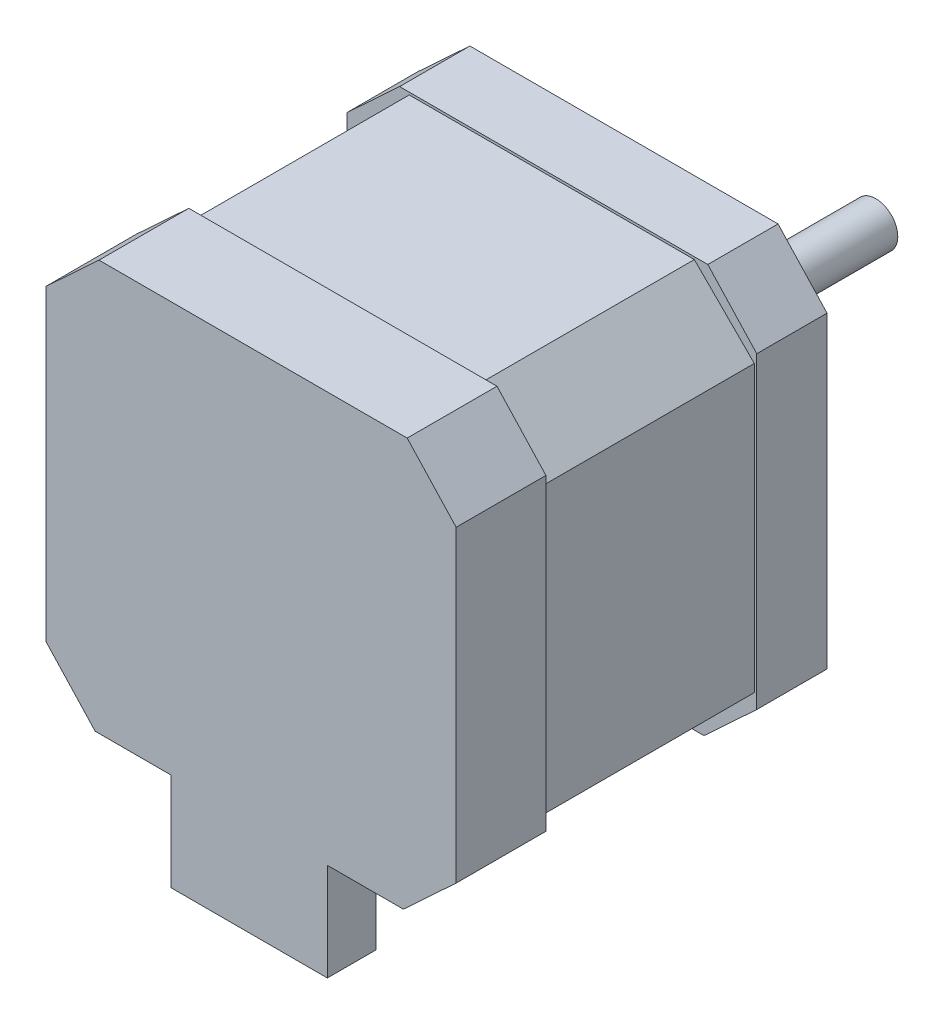
from build123d import *

# Parameters (mm, degrees)
RESSALTO_EXTRUS_O1_DEPTH   = 38
CORTE_EXTRUS_O_FINA1_START = -30.8
CORTE_EXTRUS_O_FINA1_DEPTH = 21.6
ESBO_O3_R                  = 2.25
RESSALTO_EXTRUS_O2_DEPTH   = 26
ESBO_O4_R                  = 10
RESSALTO_EXTRUS_O3_DEPTH   = 2
ESBO_O5_R                  = 1.5
CORTE_EXTRUS_O1_DEPTH      = 10
ESBO_O7_W                  = 16
ESBO_O7_H                  = 5
RESSALTO_EXTRUS_O4_DEPTH   = 10


# Read off the part's stored shape, not the designer's step: Corte-Extrusão-Fina1
with BuildPart() as part:
    # Esboço1 → Ressalto-extrusão1 (new body)
    with BuildSketch(Plane.XY):
        Polygon((-21, -15.592171873), (-15.984175996, -21), (15.592171873, -21), (21, -15.984175996), (21, 15.592171873), (15.984175996, 21), (-15.592171873, 21), (-21, 15.984175996), align=None)
    extrude(amount=RESSALTO_EXTRUS_O1_DEPTH)

    # Corte-Extrusão-Fina1 outline → Corte-Extrusão-Fina1 (cut)
    with BuildSketch(Plane.XY.offset(38).offset(CORTE_EXTRUS_O_FINA1_START)):
        Polygon((15.592171873, -21), (21, -15.984175996), (21, 15.592171873), (15.984175996, 21), (-15.592171873, 21), (-21, 15.984175996), (-21, -15.592171873), (-15.984175996, -21), align=None)
        Polygon((14.605339059, 20.75), (20.75, 14.605339059), (20.75, -14.605339059), (14.605339059, -20.75), (-14.605339059, -20.75), (-20.75, -14.605339059), (-20.75, 14.605339059), (-14.605339059, 20.75), align=None, mode=Mode.SUBTRACT)
    extrude(amount=CORTE_EXTRUS_O_FINA1_DEPTH, mode=Mode.SUBTRACT)

    # Esboço3 → Ressalto-extrusão2 (add)
    with BuildSketch(Plane(origin=(0, 0, 0), x_dir=(-1, 0, 0), z_dir=(0, 0, -1))):
        with Locations(Location((0, 0, 0), (0, 0, 180))):
            Circle(ESBO_O3_R)
    extrude(amount=RESSALTO_EXTRUS_O2_DEPTH)

    # Esboço4 → Ressalto-extrusão3 (add)
    with BuildSketch(Plane(origin=(0, 0, 0), x_dir=(-1, 0, 0), z_dir=(0, 0, -1))):
        with Locations(Location((0, 0, 0), (0, 0, 180))):
            Circle(ESBO_O4_R)
    extrude(amount=RESSALTO_EXTRUS_O3_DEPTH)

    # Esboço5 → Corte-extrusão1 (cut)
    with BuildSketch(Plane(origin=(0, 0, 0), x_dir=(-1, 0, 0), z_dir=(0, 0, -1))):
        with Locations((15.5, -15.5)):
            Circle(ESBO_O5_R)
        with Locations((-15.5, -15.5)):
            Circle(ESBO_O5_R)
        with Locations((-15.5, 15.5)):
            Circle(ESBO_O5_R)
        with Locations((15.5, 15.5)):
            Circle(ESBO_O5_R)
    extrude(amount=-CORTE_EXTRUS_O1_DEPTH, mode=Mode.SUBTRACT)

    # Esboço7 → Ressalto-extrusão4 (add)
    with BuildSketch(Plane.XZ.offset(21)):
        with Locations((-0.196002062, 35.5)):
            Rectangle(ESBO_O7_W, ESBO_O7_H)
    extrude(amount=RESSALTO_EXTRUS_O4_DEPTH)


solid = part.part
